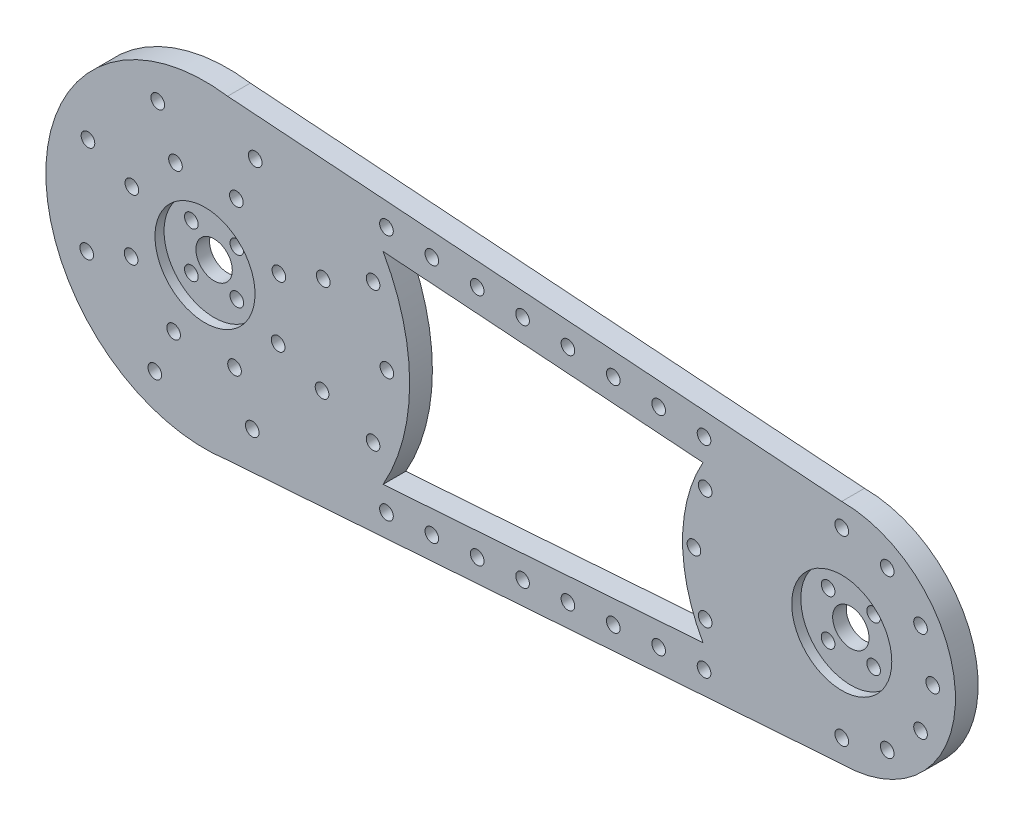
from build123d import *

# Parameters (mm, degrees)
EXTRUDE_3_DEPTH      = 5
SKETCH_4_R           = 1.5
SKETCH_4_R_2         = 4
CUT_EXTRUDE_3_DEPTH  = 5
SKETCH_5_R           = 11
CUT_EXTRUDE_4_DEPTH  = 2
SKETCH_6_R           = 1.5
CUT_EXTRUDE_6_DEPTH  = 169.745370307
SKETCH_8_R           = 1.5
CUT_EXTRUDE_8_DEPTH  = 169.745370307
SKETCH_9_R           = 1.5
EXTRUDE_4_DEPTH      = 5
SKETCH_10_R          = 1.5
EXTRUDE_6_DEPTH      = 5
SKETCH_11_R          = 11
SKETCH_11_R_2        = 1.5
EXTRUDE_12_DEPTH     = 5
SKETCH_14_R          = 1.5
CUT_EXTRUDE_9_DEPTH  = 5
EXTRUDE_START        = -5
EXTRUDE_13_DEPTH     = 5
SKETCH_16_R          = 1.5
CUT_EXTRUDE_10_DEPTH = 5
EXTRUDE_14_DEPTH     = 5
SKETCH_19_R          = 1.5
EXTRUDE_15_DEPTH     = 5
SKETCH_20_R          = 1.5
CUT_EXTRUDE_11_DEPTH = 5
EXTRUDE_16_DEPTH     = 5
SKETCH_22_R          = 1.5
EXTRUDE_17_DEPTH     = 5
SKETCH_23_R          = 1.5
CUT_EXTRUDE_15_DEPTH = 5
SKETCH_24_R          = 1.5
EXTRUDE_21_DEPTH     = 5
SKETCH_29_R          = 1.5
EXTRUDE_22_DEPTH     = 5


with BuildPart() as part:
    # 草图1 → 凸台-拉伸3 (new body)
    with BuildSketch(Plane.XY):
        with BuildLine():
            Line((140, 25), (0, 35))
            ThreePointArc((0, 35), (-35, 0), (0, -35))
            Line((0, -35), (140, -25))
            ThreePointArc((140, -25), (165, 0), (140, 25))
        make_face()
    extrude(amount=EXTRUDE_3_DEPTH)

    # 草图4 → 切除-拉伸3 (cut)
    with BuildSketch(Plane.XY.offset(5)):
        with Locations((-5, -5)):
            Circle(SKETCH_4_R)
        with Locations((5, -5)):
            Circle(SKETCH_4_R)
        with Locations((-5, 5)):
            Circle(SKETCH_4_R)
        with Locations((5, 5)):
            Circle(SKETCH_4_R)
        with Locations((135, -5)):
            Circle(SKETCH_4_R)
        with Locations((145, -5)):
            Circle(SKETCH_4_R)
        with Locations((135, 5)):
            Circle(SKETCH_4_R)
        with Locations((145, 5)):
            Circle(SKETCH_4_R)
        Circle(SKETCH_4_R_2)
        with Locations((140, 0)):
            Circle(SKETCH_4_R_2)
    extrude(amount=-CUT_EXTRUDE_3_DEPTH, mode=Mode.SUBTRACT)

    # 草图5 → 切除-拉伸4 (cut)
    with BuildSketch(Plane.XY.offset(5)):
        Circle(SKETCH_5_R)
        with Locations((140, 0)):
            Circle(SKETCH_5_R)
    extrude(amount=-CUT_EXTRUDE_4_DEPTH, mode=Mode.SUBTRACT)

    # 草图6 → 切除-拉伸6 (cut, through all)
    with BuildSketch(Plane.XY.offset(5)):
        with Locations((30, 0)):
            Circle(SKETCH_6_R)
        with Locations((25.980762114, 15)):
            Circle(SKETCH_6_R)
        with Locations((25.980762114, -15)):
            Circle(SKETCH_6_R)
        with Locations((15, 25.980762114)):
            Circle(SKETCH_6_R)
        with Locations((15, -25.980762114)):
            Circle(SKETCH_6_R)
        with Locations((0, 30)):
            Circle(SKETCH_6_R)
        with Locations((0, -30)):
            Circle(SKETCH_6_R)
        with Locations((-15, 25.980762114)):
            Circle(SKETCH_6_R)
        with Locations((-15, -25.980762114)):
            Circle(SKETCH_6_R)
        with Locations((-25.980762114, 15)):
            Circle(SKETCH_6_R)
        with Locations((-25.980762114, -15)):
            Circle(SKETCH_6_R)
        with Locations((-30, 0)):
            Circle(SKETCH_6_R)
        with Locations((160, 0)):
            Circle(SKETCH_6_R)
        with Locations((157.320508076, 10)):
            Circle(SKETCH_6_R)
        with Locations((157.320508076, -10)):
            Circle(SKETCH_6_R)
        with Locations((150, 17.320508076)):
            Circle(SKETCH_6_R)
        with Locations((150, -17.320508076)):
            Circle(SKETCH_6_R)
        with Locations((140, 20)):
            Circle(SKETCH_6_R)
        with Locations((140, -20)):
            Circle(SKETCH_6_R)
        with Locations((130, 17.320508076)):
            Circle(SKETCH_6_R)
        with Locations((130, -17.320508076)):
            Circle(SKETCH_6_R)
        with Locations((122.679491924, 10)):
            Circle(SKETCH_6_R)
        with Locations((122.679491924, -10)):
            Circle(SKETCH_6_R)
        with Locations((120, 0)):
            Circle(SKETCH_6_R)
    extrude(amount=-CUT_EXTRUDE_6_DEPTH, mode=Mode.SUBTRACT)

    # 草图8 → 切除-拉伸8 (cut, through all)
    with BuildSketch(Plane.XY.offset(5)):
        with Locations((9.974586998, -29.2875295)):
            Circle(SKETCH_8_R)
        with Locations((19.949173997, -28.575059)):
            Circle(SKETCH_8_R)
        with Locations((9.974586998, 29.2875295)):
            Circle(SKETCH_8_R)
        with BuildLine():
            ThreePointArc((26.297708958, 23.096114469), (35, 0), (26.297708958, -23.096114469))
            Line((26.297708958, -23.096114469), (121.06763386, -16.326834119))
            ThreePointArc((121.06763386, -16.326834119), (115, 0), (121.06763386, 16.326834119))
            Line((121.06763386, 16.326834119), (26.297708958, 23.096114469))
        make_face()
        with Locations((19.949173997, 28.575059)):
            Circle(SKETCH_8_R)
        with Locations((29.923760995, -27.8625885)):
            Circle(SKETCH_8_R)
        with Locations((39.898347993, -27.150118)):
            Circle(SKETCH_8_R)
        with Locations((119.69504398, -21.450354001)):
            Circle(SKETCH_8_R)
        with Locations((129.669630978, -20.737883502)):
            Circle(SKETCH_8_R)
        with Locations((29.923760995, 27.8625885)):
            Circle(SKETCH_8_R)
        with Locations((129.669630978, 20.737883502)):
            Circle(SKETCH_8_R)
        with Locations((119.69504398, 21.450354001)):
            Circle(SKETCH_8_R)
        with Locations((49.872934992, -26.437647501)):
            Circle(SKETCH_8_R)
        with Locations((109.720456981, -22.162824501)):
            Circle(SKETCH_8_R)
        with Locations((39.898347993, 27.150118)):
            Circle(SKETCH_8_R)
        with Locations((109.720456981, 22.162824501)):
            Circle(SKETCH_8_R)
        with Locations((59.84752199, -25.725177001)):
            Circle(SKETCH_8_R)
        with Locations((99.745869983, -22.875295001)):
            Circle(SKETCH_8_R)
        with Locations((49.872934992, 26.437647501)):
            Circle(SKETCH_8_R)
        with Locations((99.745869983, 22.875295001)):
            Circle(SKETCH_8_R)
        with Locations((69.822108988, -25.012706501)):
            Circle(SKETCH_8_R)
        with Locations((89.771282985, -23.587765501)):
            Circle(SKETCH_8_R)
        with Locations((59.84752199, 25.725177001)):
            Circle(SKETCH_8_R)
        with Locations((89.771282985, 23.587765501)):
            Circle(SKETCH_8_R)
        with Locations((79.796695986, -24.300236001)):
            Circle(SKETCH_8_R)
        with Locations((69.822108988, 25.012706501)):
            Circle(SKETCH_8_R)
        with Locations((79.796695986, 24.300236001)):
            Circle(SKETCH_8_R)
    extrude(amount=-CUT_EXTRUDE_8_DEPTH, mode=Mode.SUBTRACT)

    # 草图9 → 凸台-拉伸4 (add)
    with BuildSketch(Plane.XY.offset(5)):
        with Locations((15, 25.980762114)):
            Circle(SKETCH_9_R)
        with Locations((15, -25.980762114)):
            Circle(SKETCH_9_R)
    extrude(amount=-EXTRUDE_4_DEPTH)

    # 草图10 → 凸台-拉伸6 (add)
    with BuildSketch(Plane.XY.offset(5)):
        with Locations((130, -17.320508076)):
            Circle(SKETCH_10_R)
        with Locations((130, 17.320508076)):
            Circle(SKETCH_10_R)
    extrude(amount=-EXTRUDE_6_DEPTH)

    # 草图11 → 凸台-拉伸12 (add)
    # profile 1 of 7: a face of its own
    with BuildSketch(Plane.XY.offset(5)):
        with BuildLine():
            ThreePointArc((21.242995392, -27.816095103), (35, 0), (21.242995392, 27.816095103))
            ThreePointArc((21.242995392, 27.816095103), (20.807825204, 29.804985057), (18.79080718, 29.5280471))
            ThreePointArc((18.79080718, 29.5280471), (-35, 0), (18.79080718, -29.5280471))
            ThreePointArc((18.79080718, -29.5280471), (20.807825204, -29.804985057), (21.242995392, -27.816095103))
        make_face()
        Circle(SKETCH_11_R, mode=Mode.SUBTRACT)
    # profile 2 of 7: a face of its own
    with BuildSketch(Plane.XY.offset(5)):
        with Locations((119.69504398, 21.450354001)):
            Circle(SKETCH_11_R_2)
    # profile 3 of 7: a face of its own
    with BuildSketch(Plane.XY.offset(5)):
        with Locations((119.69504398, -21.450354001)):
            Circle(SKETCH_11_R_2)
    # profile 4 of 7: a face of its own
    with BuildSketch(Plane.XY.offset(5)):
        with Locations((29.923760995, -27.8625885)):
            Circle(SKETCH_11_R_2)
    # profile 5 of 7: a face of its own
    with BuildSketch(Plane.XY.offset(5)):
        with Locations((29.923760995, 27.8625885)):
            Circle(SKETCH_11_R_2)
    # profile 6 of 7: a face of its own
    with BuildSketch(Plane.XY.offset(5)):
        with Locations((129.669630978, -20.737883502)):
            Circle(SKETCH_11_R_2)
    # profile 7 of 7: a face of its own
    with BuildSketch(Plane.XY.offset(5)):
        with Locations((129.669630978, 20.737883502)):
            Circle(SKETCH_11_R_2)
    extrude(amount=-EXTRUDE_12_DEPTH)

    # 草图14 → 切除-拉伸9 (cut)
    with BuildSketch(Plane(origin=(0, 0, 0), x_dir=(-1, 0, 0), z_dir=(0, 0, -1))):
        with Locations((-11.039598696, 25.731833604)):
            Circle(SKETCH_14_R)
        with Locations((-6.899749185, 16.082396003)):
            Circle(SKETCH_14_R)
        with Locations((6.493111834, 16.250830708)):
            Circle(SKETCH_14_R)
        with Locations((10.388978935, 26.001329133)):
            Circle(SKETCH_14_R)
        with Locations((16.082396003, 6.899749185)):
            Circle(SKETCH_14_R)
        with Locations((25.731833604, 11.039598696)):
            Circle(SKETCH_14_R)
        with Locations((16.250830708, -6.493111834)):
            Circle(SKETCH_14_R)
        with Locations((26.001329133, -10.388978935)):
            Circle(SKETCH_14_R)
        with Locations((6.899749185, -16.082396003)):
            Circle(SKETCH_14_R)
        with Locations((11.039598696, -25.731833604)):
            Circle(SKETCH_14_R)
        with Locations((-6.493111834, -16.250830708)):
            Circle(SKETCH_14_R)
        with Locations((-10.388978935, -26.001329133)):
            Circle(SKETCH_14_R)
        with Locations((-16.082396003, -6.899749185)):
            Circle(SKETCH_14_R)
        with Locations((-25.731833604, -11.039598696)):
            Circle(SKETCH_14_R)
        with Locations((-16.250830708, 6.493111834)):
            Circle(SKETCH_14_R)
        with Locations((-26.001329133, 10.388978935)):
            Circle(SKETCH_14_R)
    extrude(amount=-CUT_EXTRUDE_9_DEPTH, mode=Mode.SUBTRACT)

    # 草图15 → 凸台-拉伸13 (add)
    with BuildSketch(Plane(origin=(0, 0, 0), x_dir=(-1, 0, 0), z_dir=(0, 0, -1)).offset(EXTRUDE_START)):
        with BuildLine():
            Line((-32.991302599, -22.618000638), (-26.297708958, -23.096114469))
            ThreePointArc((-26.297708958, -23.096114469), (-35, 0), (-26.297708958, 23.096114469))
            Line((-26.297708958, 23.096114469), (-32.991302599, 22.618000638))
            ThreePointArc((-32.991302599, 22.618000638), (-40, 0), (-32.991302599, -22.618000638))
        make_face()
    extrude(amount=EXTRUDE_13_DEPTH)

    # 草图16 → 切除-拉伸10 (cut)
    with BuildSketch(Plane(origin=(0, 0, 0), x_dir=(-1, 0, 0), z_dir=(0, 0, -1))):
        with Locations((-35, 0)):
            Circle(SKETCH_16_R)
        with Locations((-32.335783638, 13.393920133)):
            Circle(SKETCH_16_R)
        with Locations((-32.335783638, -13.393920133)):
            Circle(SKETCH_16_R)
    extrude(amount=-CUT_EXTRUDE_10_DEPTH, mode=Mode.SUBTRACT)

    # 草图18 → 凸台-拉伸14 (add)
    with BuildSketch(Plane.XY.offset(5)):
        with BuildLine():
            Line((39.15545217, 22.17770424), (32.991302599, 22.618000638))
            ThreePointArc((32.991302599, 22.618000638), (38.207670067, 11.83950793), (40, 0))
            ThreePointArc((40, 0), (38.207670067, -11.83950793), (32.991302599, -22.618000638))
            Line((32.991302599, -22.618000638), (39.15545217, -22.17770424))
            ThreePointArc((39.15545217, -22.17770424), (43.514338715, -11.467446366), (45, 0))
            ThreePointArc((45, 0), (43.514338715, 11.467446366), (39.15545217, 22.17770424))
        make_face()
    extrude(amount=-EXTRUDE_14_DEPTH)

    # 草图19 → 凸台-拉伸15 (add)
    with BuildSketch(Plane.XY.offset(5).offset(EXTRUDE_START)):
        with Locations((32.335783638, 13.393920133)):
            Circle(SKETCH_19_R)
        with Locations((35, 0)):
            Circle(SKETCH_19_R)
        with Locations((32.335783638, -13.393920133)):
            Circle(SKETCH_19_R)
    extrude(amount=EXTRUDE_15_DEPTH)

    # 草图20 → 切除-拉伸11 (cut)
    with BuildSketch(Plane(origin=(0, 0, 0), x_dir=(-1, 0, 0), z_dir=(0, 0, -1))):
        with Locations((-40, 0)):
            Circle(SKETCH_20_R)
        with Locations((-36.9551813, 15.307337295)):
            Circle(SKETCH_20_R)
        with Locations((-15.307337295, 36.9551813)):
            Circle(SKETCH_20_R)
        with Locations((0, 40)):
            Circle(SKETCH_20_R)
        with Locations((15.307337295, 36.9551813)):
            Circle(SKETCH_20_R)
        with Locations((28.284271247, 28.284271247)):
            Circle(SKETCH_20_R)
        with Locations((36.9551813, 15.307337295)):
            Circle(SKETCH_20_R)
        with Locations((40, 0)):
            Circle(SKETCH_20_R)
        with Locations((36.9551813, -15.307337295)):
            Circle(SKETCH_20_R)
        with Locations((28.284271247, -28.284271247)):
            Circle(SKETCH_20_R)
        with Locations((15.307337295, -36.9551813)):
            Circle(SKETCH_20_R)
        with Locations((0, -40)):
            Circle(SKETCH_20_R)
        with Locations((-15.307337295, -36.9551813)):
            Circle(SKETCH_20_R)
        with Locations((-36.9551813, -15.307337295)):
            Circle(SKETCH_20_R)
    extrude(amount=-CUT_EXTRUDE_11_DEPTH, mode=Mode.SUBTRACT)

    # 草图21 → 凸台-拉伸16 (add)
    with BuildSketch(Plane(origin=(0, 0, 0), x_dir=(-1, 0, 0), z_dir=(0, 0, -1))):
        with BuildLine():
            ThreePointArc((-121.06763386, 16.326834119), (-115, 0), (-121.06763386, -16.326834119))
            Line((-121.06763386, -16.326834119), (-115.112957921, -16.752168115))
            ThreePointArc((-115.112957921, -16.752168115), (-110, 0), (-115.112957921, 16.752168115))
            Line((-115.112957921, 16.752168115), (-121.06763386, 16.326834119))
        make_face()
    extrude(amount=-EXTRUDE_16_DEPTH)

    # 草图22 → 凸台-拉伸17 (add)
    with BuildSketch(Plane.XY.offset(5)):
        with Locations((122.679491924, 10)):
            Circle(SKETCH_22_R)
        with Locations((120, 0)):
            Circle(SKETCH_22_R)
        with Locations((122.679491924, -10)):
            Circle(SKETCH_22_R)
    extrude(amount=-EXTRUDE_17_DEPTH)

    # 草图23 → 切除-拉伸15 (cut)
    with BuildSketch(Plane.XY.offset(5)):
        with Locations((116.184301396, 13.75)):
            Circle(SKETCH_23_R)
        with Locations((116.184301396, -13.75)):
            Circle(SKETCH_23_R)
        with Locations((112.5, 0)):
            Circle(SKETCH_23_R)
    extrude(amount=-CUT_EXTRUDE_15_DEPTH, mode=Mode.SUBTRACT)

    # 草图24 → 凸台-拉伸21 (add)
    with BuildSketch(Plane.XY.offset(5)):
        with Locations((116.184301396, 13.75)):
            Circle(SKETCH_24_R)
        with Locations((112.5, 0)):
            Circle(SKETCH_24_R)
        with Locations((116.184301396, -13.75)):
            Circle(SKETCH_24_R)
    extrude(amount=-EXTRUDE_21_DEPTH)

    # 草图29 → 凸台-拉伸22 (add)
    with BuildSketch(Plane.XY.offset(5).offset(EXTRUDE_START)):
        with BuildLine():
            ThreePointArc((115.112957921, -16.752168115), (110, 0), (115.112957921, 16.752168115))
            Line((115.112957921, 16.752168115), (109.491783992, 17.153680538))
            ThreePointArc((109.491783992, 17.153680538), (105, 0), (109.491783992, -17.153680538))
            Line((109.491783992, -17.153680538), (115.112957921, -16.752168115))
        make_face()
        with Locations((109.973915193, -12.437211552)):
            Circle(SKETCH_29_R, mode=Mode.SUBTRACT)
        with Locations((107.5, 0)):
            Circle(SKETCH_29_R, mode=Mode.SUBTRACT)
        with Locations((109.973915193, 12.437211552)):
            Circle(SKETCH_29_R, mode=Mode.SUBTRACT)
    extrude(amount=EXTRUDE_22_DEPTH)


solid = part.part
